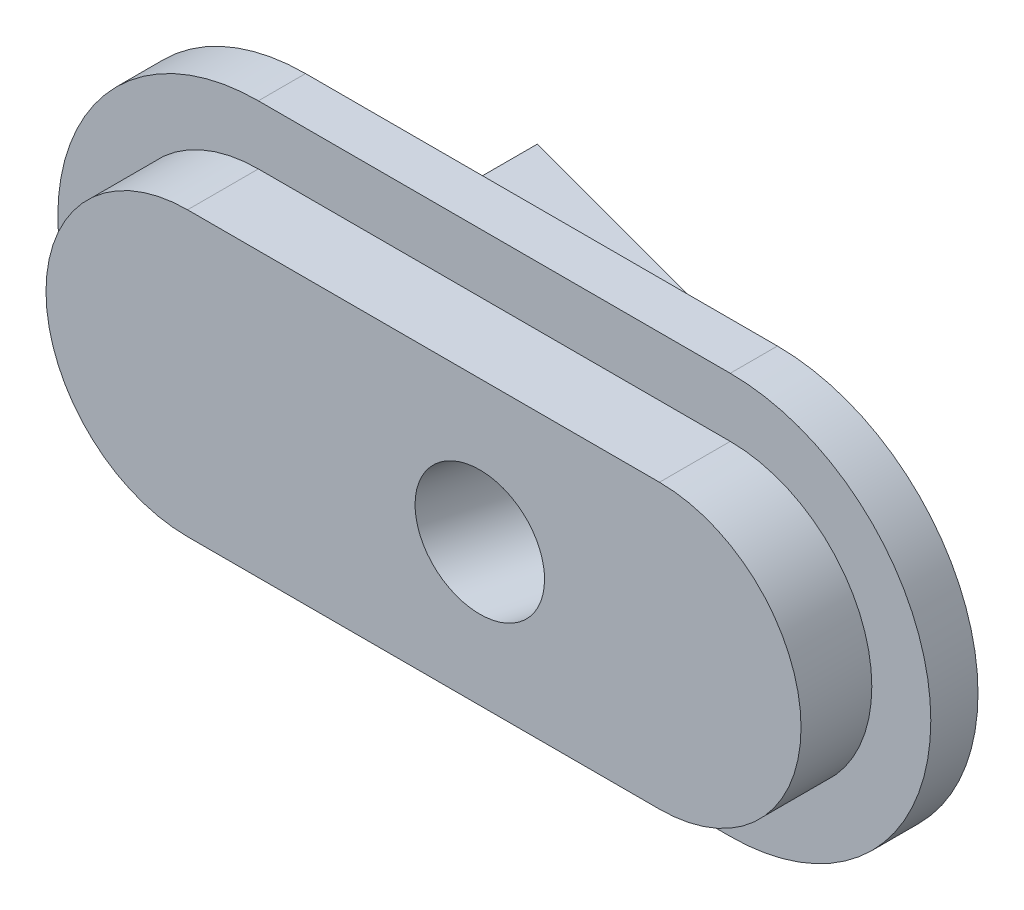
from build123d import *

# Parameters (mm, degrees)
BOSS_EXTRUDE1_DEPTH             = 5
BOSS_EXTRUDE2_REACH             = 19.804
BOSS_EXTRUDE2_DIRECTION_2_REACH = 19.804
BOSS_EXTRUDE3_DEPTH             = 2
SKETCH4_R                       = 2.65
CUT_EXTRUDE1_DEPTH              = 29.091194779
SKETCH9_W                       = 66.417569351
SKETCH9_H                       = 23.339186988
CUT_EXTRUDE2_DEPTH              = 24.5


with BuildPart() as part:
    # Sketch2 → Boss-Extrude1 (new, symmetric)
    with BuildSketch(Plane.XY):
        with BuildLine():
            Line((-10, 6), (10, 6))
            ThreePointArc((10, 6), (16, 0), (10, -6))
            Line((10, -6), (-10, -6))
            ThreePointArc((-10, -6), (-16, 0), (-10, 6))
        make_face()
    extrude(amount=BOSS_EXTRUDE1_DEPTH, both=True)

    # Boss-Extrude2: up to this face of the body (flat: up to its plane)
    boss_extrude2_end = Plane(part.part.faces().sort_by_distance((0, 6, 0))[0])
    # Sketch3 → Boss-Extrude2 (add, up to the picked face)
    with BuildSketch(Plane(origin=(0, 0, 0), x_dir=(1, 0, 0), z_dir=(0, 1, 0)), mode=Mode.PRIVATE) as boss_extrude2_sk1:
        Polygon((-5, 5), (-5, 9.823085464), (13, 5), align=None)
    boss_extrude2_tool1 = split(extrude(boss_extrude2_sk1.sketch, amount=BOSS_EXTRUDE2_REACH, mode=Mode.PRIVATE), bisect_by=boss_extrude2_end, keep=Keep.BOTH, mode=Mode.PRIVATE)
    # Sketch3 → Boss-Extrude2 (add, up to the picked face)
    with BuildSketch(Plane(origin=(0, 0, 0), x_dir=(1, 0, 0), z_dir=(0, 1, 0)), mode=Mode.PRIVATE) as boss_extrude2_sk2:
        Polygon((-11, -5), (7, -9.823085464), (7, -5), align=None)
    boss_extrude2_tool2 = split(extrude(boss_extrude2_sk2.sketch, amount=BOSS_EXTRUDE2_REACH, mode=Mode.PRIVATE), bisect_by=boss_extrude2_end, keep=Keep.BOTH, mode=Mode.PRIVATE)
    add(boss_extrude2_tool1.solids().sort_by(Axis((1, 0, -6.607695), (0, 1, 0)))[0])
    add(boss_extrude2_tool2.solids().sort_by(Axis((1, 0, 6.607695), (0, 1, 0)))[0])

    # Boss-Extrude2 direction 2: up to this face of the body (flat: up to its plane)
    boss_extrude2_direction_2_end = Plane(part.part.faces().sort_by_distance((0, -6, 0))[0])
    # Sketch3 → Boss-Extrude2 direction 2 (add, up to the picked face)
    with BuildSketch(Plane(origin=(0, 0, 0), x_dir=(1, 0, 0), z_dir=(0, 1, 0)), mode=Mode.PRIVATE) as boss_extrude2_direction_2_sk1:
        Polygon((-5, 5), (-5, 9.823085464), (13, 5), align=None)
    boss_extrude2_direction_2_tool1 = split(extrude(boss_extrude2_direction_2_sk1.sketch, amount=-BOSS_EXTRUDE2_DIRECTION_2_REACH, mode=Mode.PRIVATE), bisect_by=boss_extrude2_direction_2_end, keep=Keep.BOTH, mode=Mode.PRIVATE)
    # Sketch3 → Boss-Extrude2 direction 2 (add, up to the picked face)
    with BuildSketch(Plane(origin=(0, 0, 0), x_dir=(1, 0, 0), z_dir=(0, 1, 0)), mode=Mode.PRIVATE) as boss_extrude2_direction_2_sk2:
        Polygon((-11, -5), (7, -9.823085464), (7, -5), align=None)
    boss_extrude2_direction_2_tool2 = split(extrude(boss_extrude2_direction_2_sk2.sketch, amount=-BOSS_EXTRUDE2_DIRECTION_2_REACH, mode=Mode.PRIVATE), bisect_by=boss_extrude2_direction_2_end, keep=Keep.BOTH, mode=Mode.PRIVATE)
    add(boss_extrude2_direction_2_tool1.solids().sort_by(Axis((1, 0, -6.607695), (0, -1, 0)))[0])
    add(boss_extrude2_direction_2_tool2.solids().sort_by(Axis((1, 0, 6.607695), (0, -1, 0)))[0])

    # Sketch8 → Boss-Extrude3 (add)
    with BuildSketch(Plane.XY.offset(5)):
        with BuildLine():
            Line((-10, 8.5), (10, 8.5))
            ThreePointArc((10, 8.5), (18.5, 0), (10, -8.5))
            Line((10, -8.5), (-10, -8.5))
            ThreePointArc((-10, -8.5), (-18.5, 0), (-10, 8.5))
        make_face()
    boss_extrude3 = extrude(amount=-BOSS_EXTRUDE3_DEPTH)

    # Mirror1: Boss-Extrude3 across plane
    add(boss_extrude3.mirror(Plane.XY))

    # Sketch4 → Cut-Extrude1 (cut, through all)
    with BuildSketch(Plane(origin=(-1.986860279, 0, 7.415063509), x_dir=(0.96592582628907, 0, 0.25881904510251436), z_dir=(-0.25881904510251436, 0, 0.96592582628907))):
        with Locations((2.303882384, 0)):
            Circle(SKETCH4_R)
    extrude(amount=-CUT_EXTRUDE1_DEPTH, mode=Mode.SUBTRACT)

    # Sketch9 → Cut-Extrude2 (cut, symmetric)
    with BuildSketch(Plane(origin=(0, 0, 0), x_dir=(1, 0, 0), z_dir=(0, 1, 0))):
        with Locations((0.552098297, -11.669593494)):
            Rectangle(SKETCH9_W, SKETCH9_H)
    extrude(amount=CUT_EXTRUDE2_DEPTH, both=True, mode=Mode.SUBTRACT)


solid = part.part
